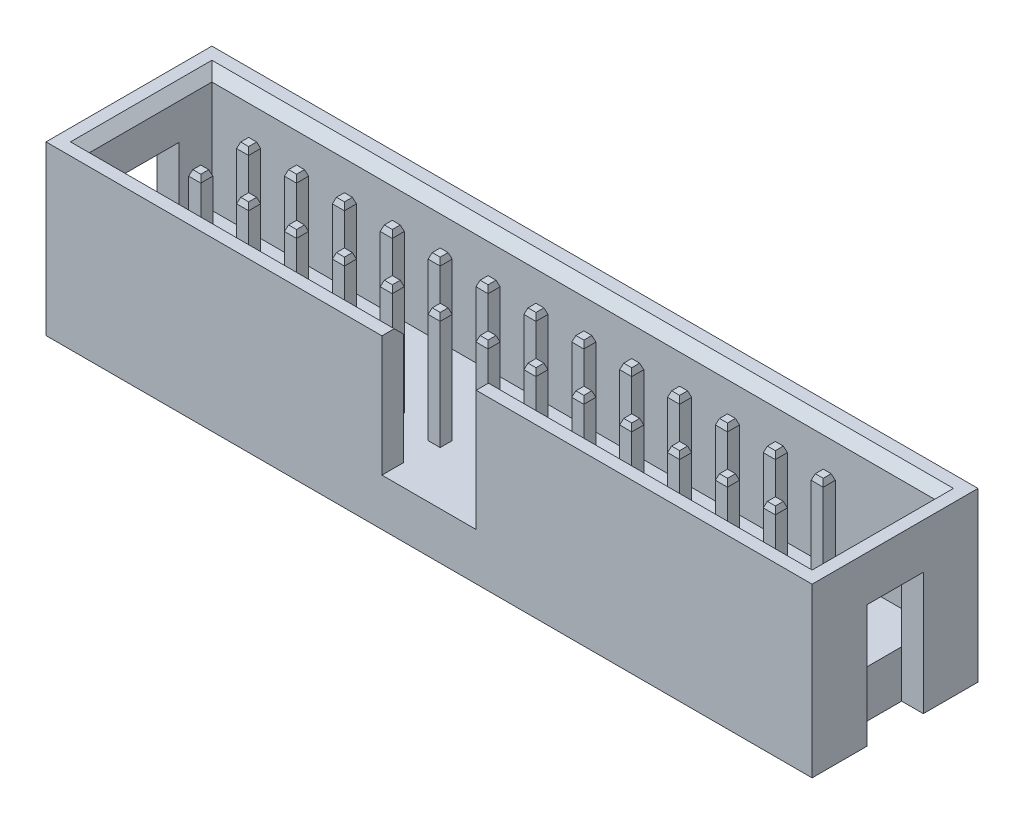
from build123d import *
from OCP.BRepFilletAPI import BRepFilletAPI_MakeChamfer

# Parameters (mm, degrees)
SKETCH1_W                = 40.64
SKETCH1_H                = 8.8
BOSS_EXTRUDE1_DEPTH      = 2.5
BOSS_EXTRUDE2_DEPTH      = 6.4
SKETCH3_W                = 1.15
SKETCH3_H                = 3
CUT_EXTRUDE1_DEPTH       = 6.5
BOSS_EXTRUDE3_DEPTH      = 6.1
BOSS_EXTRUDE3_DEPTH_BACK = 5.5
SKETCH4_W                = 0.64
SKETCH4_H                = 0.64
CHAMFER2_SIZE            = 0.2
CHAMFER2_SIZE2           = 0.549495484
CHAMFER3_SIZE            = 0.3
CHAMFER3_SIZE2           = 0.10919107
CHAMFER4_SIZE            = 0.5


with BuildPart() as part:
    # Sketch1 → Boss-Extrude1 (new body)
    with BuildSketch(Plane(origin=(0, 0, 0), x_dir=(1, 0, 0), z_dir=(0, 1, 0))):
        Rectangle(SKETCH1_W, SKETCH1_H)
    extrude(amount=BOSS_EXTRUDE1_DEPTH)

    # Sketch2 → Boss-Extrude2 (add)
    with BuildSketch(Plane(origin=(0, 2.5, 0), x_dir=(1, 0, 0), z_dir=(0, 1, 0))):
        Polygon((20.32, 4.4), (-20.32, 4.4), (-20.32, -4.4), (-2.5, -4.4), (-2.5, -3.25), (-19.17, -3.25), (-19.17, 3.25), (19.17, 3.25), (19.17, -3.25), (2.5, -3.25), (2.5, -4.4), (20.32, -4.4), align=None)
    extrude(amount=BOSS_EXTRUDE2_DEPTH)

    # Sketch3 → Cut-Extrude1 (cut)
    with BuildSketch(Plane.XZ):
        with Locations((19.745, 0)):
            Rectangle(SKETCH3_W, SKETCH3_H)
        with Locations((-19.745, 0)):
            Rectangle(SKETCH3_W, SKETCH3_H)
    extrude(amount=-CUT_EXTRUDE1_DEPTH, mode=Mode.SUBTRACT)

    # Sketch4 → Boss-Extrude3 (add, two sides: drawn at the far end of the back side and taken through both)
    with BuildSketch(Plane(origin=(0, 2.5, 0), x_dir=(1, 0, 0), z_dir=(0, 1, 0)).offset(-BOSS_EXTRUDE3_DEPTH_BACK)):
        with Locations((-15.24, 1.27)):
            Rectangle(SKETCH4_W, SKETCH4_H)
        with Locations((-12.7, 1.27)):
            Rectangle(SKETCH4_W, SKETCH4_H)
        with Locations((-10.16, 1.27)):
            Rectangle(SKETCH4_W, SKETCH4_H)
        with Locations((-7.62, 1.27)):
            Rectangle(SKETCH4_W, SKETCH4_H)
        with Locations((-5.08, 1.27)):
            Rectangle(SKETCH4_W, SKETCH4_H)
        with Locations((-2.54, 1.27)):
            Rectangle(SKETCH4_W, SKETCH4_H)
        with Locations((0, 1.27)):
            Rectangle(SKETCH4_W, SKETCH4_H)
        with Locations((2.54, 1.27)):
            Rectangle(SKETCH4_W, SKETCH4_H)
        with Locations((5.08, 1.27)):
            Rectangle(SKETCH4_W, SKETCH4_H)
        with Locations((7.62, 1.27)):
            Rectangle(SKETCH4_W, SKETCH4_H)
        with Locations((10.16, 1.27)):
            Rectangle(SKETCH4_W, SKETCH4_H)
        with Locations((12.7, 1.27)):
            Rectangle(SKETCH4_W, SKETCH4_H)
        with Locations((15.24, 1.27)):
            Rectangle(SKETCH4_W, SKETCH4_H)
        with Locations((-12.7, -1.27)):
            Rectangle(SKETCH4_W, SKETCH4_H)
        with Locations((-10.16, -1.27)):
            Rectangle(SKETCH4_W, SKETCH4_H)
        with Locations((-7.62, -1.27)):
            Rectangle(SKETCH4_W, SKETCH4_H)
        with Locations((-5.08, -1.27)):
            Rectangle(SKETCH4_W, SKETCH4_H)
        with Locations((-2.54, -1.27)):
            Rectangle(SKETCH4_W, SKETCH4_H)
        with Locations((0, -1.27)):
            Rectangle(SKETCH4_W, SKETCH4_H)
        with Locations((2.54, -1.27)):
            Rectangle(SKETCH4_W, SKETCH4_H)
        with Locations((5.08, -1.27)):
            Rectangle(SKETCH4_W, SKETCH4_H)
        with Locations((7.62, -1.27)):
            Rectangle(SKETCH4_W, SKETCH4_H)
        with Locations((10.16, -1.27)):
            Rectangle(SKETCH4_W, SKETCH4_H)
        with Locations((12.7, -1.27)):
            Rectangle(SKETCH4_W, SKETCH4_H)
        with Locations((15.24, -1.27)):
            Rectangle(SKETCH4_W, SKETCH4_H)
        with Locations((-15.24, -1.27)):
            Rectangle(SKETCH4_W, SKETCH4_H)
    extrude(amount=BOSS_EXTRUDE3_DEPTH + BOSS_EXTRUDE3_DEPTH_BACK)

    # Chamfer2: one chamfer whose edges measure the first distance from different faces: ONE call of the kernel's chamfer builder (chamfer() names one face for all edges)
    chamfer2_edges_1 = [part.edges().sort_by_distance(p)[0] for p in [
        (-14.92, -3, 1.27),
        (-15.24, -3, 0.95),
        (-15.56, -3, 1.27),
        (-15.24, -3, 1.59),
    ]]
    chamfer2_side_1 = [part.faces().sort_by_distance(p)[0] for p in [
        (-15.24, -3, 1.27),
    ]]
    chamfer2_edges_2 = [part.edges().sort_by_distance(p)[0] for p in [
        (15.56, -3, 1.27),
        (15.24, -3, 0.95),
        (14.92, -3, 1.27),
        (15.24, -3, 1.59),
    ]]
    chamfer2_side_2 = [part.faces().sort_by_distance(p)[0] for p in [
        (15.24, -3, 1.27),
    ]]
    chamfer2_edges_3 = [part.edges().sort_by_distance(p)[0] for p in [
        (13.02, -3, 1.27),
        (12.7, -3, 0.95),
        (12.38, -3, 1.27),
        (12.7, -3, 1.59),
    ]]
    chamfer2_side_3 = [part.faces().sort_by_distance(p)[0] for p in [
        (12.7, -3, 1.27),
    ]]
    chamfer2_edges_4 = [part.edges().sort_by_distance(p)[0] for p in [
        (10.48, -3, 1.27),
        (10.16, -3, 0.95),
        (9.84, -3, 1.27),
        (10.16, -3, 1.59),
    ]]
    chamfer2_side_4 = [part.faces().sort_by_distance(p)[0] for p in [
        (10.16, -3, 1.27),
    ]]
    chamfer2_edges_5 = [part.edges().sort_by_distance(p)[0] for p in [
        (7.94, -3, 1.27),
        (7.62, -3, 0.95),
        (7.3, -3, 1.27),
        (7.62, -3, 1.59),
    ]]
    chamfer2_side_5 = [part.faces().sort_by_distance(p)[0] for p in [
        (7.62, -3, 1.27),
    ]]
    chamfer2_edges_6 = [part.edges().sort_by_distance(p)[0] for p in [
        (5.4, -3, 1.27),
        (5.08, -3, 0.95),
        (4.76, -3, 1.27),
        (5.08, -3, 1.59),
    ]]
    chamfer2_side_6 = [part.faces().sort_by_distance(p)[0] for p in [
        (5.08, -3, 1.27),
    ]]
    chamfer2_edges_7 = [part.edges().sort_by_distance(p)[0] for p in [
        (2.86, -3, 1.27),
        (2.54, -3, 0.95),
        (2.22, -3, 1.27),
        (2.54, -3, 1.59),
    ]]
    chamfer2_side_7 = [part.faces().sort_by_distance(p)[0] for p in [
        (2.54, -3, 1.27),
    ]]
    chamfer2_edges_8 = [part.edges().sort_by_distance(p)[0] for p in [
        (0.32, -3, 1.27),
        (0, -3, 0.95),
        (-0.32, -3, 1.27),
        (0, -3, 1.59),
    ]]
    chamfer2_side_8 = [part.faces().sort_by_distance(p)[0] for p in [
        (0, -3, 1.27),
    ]]
    chamfer2_edges_9 = [part.edges().sort_by_distance(p)[0] for p in [
        (-2.22, -3, 1.27),
        (-2.54, -3, 0.95),
        (-2.86, -3, 1.27),
        (-2.54, -3, 1.59),
    ]]
    chamfer2_side_9 = [part.faces().sort_by_distance(p)[0] for p in [
        (-2.54, -3, 1.27),
    ]]
    chamfer2_edges_10 = [part.edges().sort_by_distance(p)[0] for p in [
        (-4.76, -3, 1.27),
        (-5.08, -3, 0.95),
        (-5.4, -3, 1.27),
        (-5.08, -3, 1.59),
    ]]
    chamfer2_side_10 = [part.faces().sort_by_distance(p)[0] for p in [
        (-5.08, -3, 1.27),
    ]]
    chamfer2_edges_11 = [part.edges().sort_by_distance(p)[0] for p in [
        (-7.3, -3, 1.27),
        (-7.62, -3, 0.95),
        (-7.94, -3, 1.27),
        (-7.62, -3, 1.59),
    ]]
    chamfer2_side_11 = [part.faces().sort_by_distance(p)[0] for p in [
        (-7.62, -3, 1.27),
    ]]
    chamfer2_edges_12 = [part.edges().sort_by_distance(p)[0] for p in [
        (-9.84, -3, 1.27),
        (-10.16, -3, 0.95),
        (-10.48, -3, 1.27),
        (-10.16, -3, 1.59),
    ]]
    chamfer2_side_12 = [part.faces().sort_by_distance(p)[0] for p in [
        (-10.16, -3, 1.27),
    ]]
    chamfer2_edges_13 = [part.edges().sort_by_distance(p)[0] for p in [
        (-12.38, -3, 1.27),
        (-12.7, -3, 0.95),
        (-13.02, -3, 1.27),
        (-12.7, -3, 1.59),
    ]]
    chamfer2_side_13 = [part.faces().sort_by_distance(p)[0] for p in [
        (-12.7, -3, 1.27),
    ]]
    chamfer2_edges_14 = [part.edges().sort_by_distance(p)[0] for p in [
        (15.56, -3, -1.27),
        (15.24, -3, -1.59),
        (14.92, -3, -1.27),
        (15.24, -3, -0.95),
    ]]
    chamfer2_side_14 = [part.faces().sort_by_distance(p)[0] for p in [
        (15.24, -3, -1.27),
    ]]
    chamfer2_edges_15 = [part.edges().sort_by_distance(p)[0] for p in [
        (13.02, -3, -1.27),
        (12.7, -3, -1.59),
        (12.38, -3, -1.27),
        (12.7, -3, -0.95),
    ]]
    chamfer2_side_15 = [part.faces().sort_by_distance(p)[0] for p in [
        (12.7, -3, -1.27),
    ]]
    chamfer2_edges_16 = [part.edges().sort_by_distance(p)[0] for p in [
        (10.48, -3, -1.27),
        (10.16, -3, -1.59),
        (9.84, -3, -1.27),
        (10.16, -3, -0.95),
    ]]
    chamfer2_side_16 = [part.faces().sort_by_distance(p)[0] for p in [
        (10.16, -3, -1.27),
    ]]
    chamfer2_edges_17 = [part.edges().sort_by_distance(p)[0] for p in [
        (7.94, -3, -1.27),
        (7.62, -3, -1.59),
        (7.3, -3, -1.27),
        (7.62, -3, -0.95),
    ]]
    chamfer2_side_17 = [part.faces().sort_by_distance(p)[0] for p in [
        (7.62, -3, -1.27),
    ]]
    chamfer2_edges_18 = [part.edges().sort_by_distance(p)[0] for p in [
        (5.4, -3, -1.27),
        (5.08, -3, -1.59),
        (4.76, -3, -1.27),
        (5.08, -3, -0.95),
    ]]
    chamfer2_side_18 = [part.faces().sort_by_distance(p)[0] for p in [
        (5.08, -3, -1.27),
    ]]
    chamfer2_edges_19 = [part.edges().sort_by_distance(p)[0] for p in [
        (2.86, -3, -1.27),
        (2.54, -3, -1.59),
        (2.22, -3, -1.27),
        (2.54, -3, -0.95),
    ]]
    chamfer2_side_19 = [part.faces().sort_by_distance(p)[0] for p in [
        (2.54, -3, -1.27),
    ]]
    chamfer2_edges_20 = [part.edges().sort_by_distance(p)[0] for p in [
        (0.32, -3, -1.27),
        (0, -3, -1.59),
        (-0.32, -3, -1.27),
        (0, -3, -0.95),
    ]]
    chamfer2_side_20 = [part.faces().sort_by_distance(p)[0] for p in [
        (0, -3, -1.27),
    ]]
    chamfer2_edges_21 = [part.edges().sort_by_distance(p)[0] for p in [
        (-2.22, -3, -1.27),
        (-2.54, -3, -1.59),
        (-2.86, -3, -1.27),
        (-2.54, -3, -0.95),
    ]]
    chamfer2_side_21 = [part.faces().sort_by_distance(p)[0] for p in [
        (-2.54, -3, -1.27),
    ]]
    chamfer2_edges_22 = [part.edges().sort_by_distance(p)[0] for p in [
        (-4.76, -3, -1.27),
        (-5.08, -3, -1.59),
        (-5.4, -3, -1.27),
        (-5.08, -3, -0.95),
    ]]
    chamfer2_side_22 = [part.faces().sort_by_distance(p)[0] for p in [
        (-5.08, -3, -1.27),
    ]]
    chamfer2_edges_23 = [part.edges().sort_by_distance(p)[0] for p in [
        (-7.3, -3, -1.27),
        (-7.62, -3, -1.59),
        (-7.94, -3, -1.27),
        (-7.62, -3, -0.95),
    ]]
    chamfer2_side_23 = [part.faces().sort_by_distance(p)[0] for p in [
        (-7.62, -3, -1.27),
    ]]
    chamfer2_edges_24 = [part.edges().sort_by_distance(p)[0] for p in [
        (-9.84, -3, -1.27),
        (-10.16, -3, -1.59),
        (-10.48, -3, -1.27),
        (-10.16, -3, -0.95),
    ]]
    chamfer2_side_24 = [part.faces().sort_by_distance(p)[0] for p in [
        (-10.16, -3, -1.27),
    ]]
    chamfer2_edges_25 = [part.edges().sort_by_distance(p)[0] for p in [
        (-12.38, -3, -1.27),
        (-12.7, -3, -1.59),
        (-13.02, -3, -1.27),
        (-12.7, -3, -0.95),
    ]]
    chamfer2_side_25 = [part.faces().sort_by_distance(p)[0] for p in [
        (-12.7, -3, -1.27),
    ]]
    chamfer2_edges_26 = [part.edges().sort_by_distance(p)[0] for p in [
        (-14.92, -3, -1.27),
        (-15.24, -3, -1.59),
        (-15.56, -3, -1.27),
        (-15.24, -3, -0.95),
    ]]
    chamfer2_side_26 = [part.faces().sort_by_distance(p)[0] for p in [
        (-15.24, -3, -1.27),
    ]]
    chamfer2 = BRepFilletAPI_MakeChamfer(part.part.solid().wrapped)
    for e in chamfer2_edges_1:
        chamfer2.Add(CHAMFER2_SIZE, CHAMFER2_SIZE2, e.wrapped, chamfer2_side_1[0].wrapped)  # the first distance lies on this face
    for e in chamfer2_edges_2:
        chamfer2.Add(CHAMFER2_SIZE, CHAMFER2_SIZE2, e.wrapped, chamfer2_side_2[0].wrapped)  # the first distance lies on this face
    for e in chamfer2_edges_3:
        chamfer2.Add(CHAMFER2_SIZE, CHAMFER2_SIZE2, e.wrapped, chamfer2_side_3[0].wrapped)  # the first distance lies on this face
    for e in chamfer2_edges_4:
        chamfer2.Add(CHAMFER2_SIZE, CHAMFER2_SIZE2, e.wrapped, chamfer2_side_4[0].wrapped)  # the first distance lies on this face
    for e in chamfer2_edges_5:
        chamfer2.Add(CHAMFER2_SIZE, CHAMFER2_SIZE2, e.wrapped, chamfer2_side_5[0].wrapped)  # the first distance lies on this face
    for e in chamfer2_edges_6:
        chamfer2.Add(CHAMFER2_SIZE, CHAMFER2_SIZE2, e.wrapped, chamfer2_side_6[0].wrapped)  # the first distance lies on this face
    for e in chamfer2_edges_7:
        chamfer2.Add(CHAMFER2_SIZE, CHAMFER2_SIZE2, e.wrapped, chamfer2_side_7[0].wrapped)  # the first distance lies on this face
    for e in chamfer2_edges_8:
        chamfer2.Add(CHAMFER2_SIZE, CHAMFER2_SIZE2, e.wrapped, chamfer2_side_8[0].wrapped)  # the first distance lies on this face
    for e in chamfer2_edges_9:
        chamfer2.Add(CHAMFER2_SIZE, CHAMFER2_SIZE2, e.wrapped, chamfer2_side_9[0].wrapped)  # the first distance lies on this face
    for e in chamfer2_edges_10:
        chamfer2.Add(CHAMFER2_SIZE, CHAMFER2_SIZE2, e.wrapped, chamfer2_side_10[0].wrapped)  # the first distance lies on this face
    for e in chamfer2_edges_11:
        chamfer2.Add(CHAMFER2_SIZE, CHAMFER2_SIZE2, e.wrapped, chamfer2_side_11[0].wrapped)  # the first distance lies on this face
    for e in chamfer2_edges_12:
        chamfer2.Add(CHAMFER2_SIZE, CHAMFER2_SIZE2, e.wrapped, chamfer2_side_12[0].wrapped)  # the first distance lies on this face
    for e in chamfer2_edges_13:
        chamfer2.Add(CHAMFER2_SIZE, CHAMFER2_SIZE2, e.wrapped, chamfer2_side_13[0].wrapped)  # the first distance lies on this face
    for e in chamfer2_edges_14:
        chamfer2.Add(CHAMFER2_SIZE, CHAMFER2_SIZE2, e.wrapped, chamfer2_side_14[0].wrapped)  # the first distance lies on this face
    for e in chamfer2_edges_15:
        chamfer2.Add(CHAMFER2_SIZE, CHAMFER2_SIZE2, e.wrapped, chamfer2_side_15[0].wrapped)  # the first distance lies on this face
    for e in chamfer2_edges_16:
        chamfer2.Add(CHAMFER2_SIZE, CHAMFER2_SIZE2, e.wrapped, chamfer2_side_16[0].wrapped)  # the first distance lies on this face
    for e in chamfer2_edges_17:
        chamfer2.Add(CHAMFER2_SIZE, CHAMFER2_SIZE2, e.wrapped, chamfer2_side_17[0].wrapped)  # the first distance lies on this face
    for e in chamfer2_edges_18:
        chamfer2.Add(CHAMFER2_SIZE, CHAMFER2_SIZE2, e.wrapped, chamfer2_side_18[0].wrapped)  # the first distance lies on this face
    for e in chamfer2_edges_19:
        chamfer2.Add(CHAMFER2_SIZE, CHAMFER2_SIZE2, e.wrapped, chamfer2_side_19[0].wrapped)  # the first distance lies on this face
    for e in chamfer2_edges_20:
        chamfer2.Add(CHAMFER2_SIZE, CHAMFER2_SIZE2, e.wrapped, chamfer2_side_20[0].wrapped)  # the first distance lies on this face
    for e in chamfer2_edges_21:
        chamfer2.Add(CHAMFER2_SIZE, CHAMFER2_SIZE2, e.wrapped, chamfer2_side_21[0].wrapped)  # the first distance lies on this face
    for e in chamfer2_edges_22:
        chamfer2.Add(CHAMFER2_SIZE, CHAMFER2_SIZE2, e.wrapped, chamfer2_side_22[0].wrapped)  # the first distance lies on this face
    for e in chamfer2_edges_23:
        chamfer2.Add(CHAMFER2_SIZE, CHAMFER2_SIZE2, e.wrapped, chamfer2_side_23[0].wrapped)  # the first distance lies on this face
    for e in chamfer2_edges_24:
        chamfer2.Add(CHAMFER2_SIZE, CHAMFER2_SIZE2, e.wrapped, chamfer2_side_24[0].wrapped)  # the first distance lies on this face
    for e in chamfer2_edges_25:
        chamfer2.Add(CHAMFER2_SIZE, CHAMFER2_SIZE2, e.wrapped, chamfer2_side_25[0].wrapped)  # the first distance lies on this face
    for e in chamfer2_edges_26:
        chamfer2.Add(CHAMFER2_SIZE, CHAMFER2_SIZE2, e.wrapped, chamfer2_side_26[0].wrapped)  # the first distance lies on this face
    add(Compound.cast(chamfer2.Shape()), mode=Mode.REPLACE)

    # Chamfer3: one chamfer whose edges measure the first distance from different faces: ONE call of the kernel's chamfer builder (chamfer() names one face for all edges)
    chamfer3_edges_1 = [part.edges().sort_by_distance(p)[0] for p in [
        (-14.92, 8.6, 1.27),
    ]]
    chamfer3_side_1 = [part.faces().sort_by_distance(p)[0] for p in [
        (-14.92, 5.55, 1.27),
    ]]
    chamfer3_edges_2 = [part.edges().sort_by_distance(p)[0] for p in [
        (-15.24, 8.6, 0.95),
    ]]
    chamfer3_side_2 = [part.faces().sort_by_distance(p)[0] for p in [
        (-15.24, 5.55, 0.95),
    ]]
    chamfer3_edges_3 = [part.edges().sort_by_distance(p)[0] for p in [
        (-15.56, 8.6, 1.27),
    ]]
    chamfer3_side_3 = [part.faces().sort_by_distance(p)[0] for p in [
        (-15.56, 5.55, 1.27),
    ]]
    chamfer3_edges_4 = [part.edges().sort_by_distance(p)[0] for p in [
        (-15.24, 8.6, 1.59),
    ]]
    chamfer3_side_4 = [part.faces().sort_by_distance(p)[0] for p in [
        (-15.24, 5.55, 1.59),
    ]]
    chamfer3_edges_5 = [part.edges().sort_by_distance(p)[0] for p in [
        (15.56, 8.6, 1.27),
    ]]
    chamfer3_side_5 = [part.faces().sort_by_distance(p)[0] for p in [
        (15.56, 5.55, 1.27),
    ]]
    chamfer3_edges_6 = [part.edges().sort_by_distance(p)[0] for p in [
        (15.24, 8.6, 0.95),
    ]]
    chamfer3_side_6 = [part.faces().sort_by_distance(p)[0] for p in [
        (15.24, 5.55, 0.95),
    ]]
    chamfer3_edges_7 = [part.edges().sort_by_distance(p)[0] for p in [
        (14.92, 8.6, 1.27),
    ]]
    chamfer3_side_7 = [part.faces().sort_by_distance(p)[0] for p in [
        (14.92, 5.55, 1.27),
    ]]
    chamfer3_edges_8 = [part.edges().sort_by_distance(p)[0] for p in [
        (15.24, 8.6, 1.59),
    ]]
    chamfer3_side_8 = [part.faces().sort_by_distance(p)[0] for p in [
        (15.24, 5.55, 1.59),
    ]]
    chamfer3_edges_9 = [part.edges().sort_by_distance(p)[0] for p in [
        (13.02, 8.6, 1.27),
    ]]
    chamfer3_side_9 = [part.faces().sort_by_distance(p)[0] for p in [
        (13.02, 5.55, 1.27),
    ]]
    chamfer3_edges_10 = [part.edges().sort_by_distance(p)[0] for p in [
        (12.7, 8.6, 0.95),
    ]]
    chamfer3_side_10 = [part.faces().sort_by_distance(p)[0] for p in [
        (12.7, 5.55, 0.95),
    ]]
    chamfer3_edges_11 = [part.edges().sort_by_distance(p)[0] for p in [
        (12.38, 8.6, 1.27),
    ]]
    chamfer3_side_11 = [part.faces().sort_by_distance(p)[0] for p in [
        (12.38, 5.55, 1.27),
    ]]
    chamfer3_edges_12 = [part.edges().sort_by_distance(p)[0] for p in [
        (12.7, 8.6, 1.59),
    ]]
    chamfer3_side_12 = [part.faces().sort_by_distance(p)[0] for p in [
        (12.7, 5.55, 1.59),
    ]]
    chamfer3_edges_13 = [part.edges().sort_by_distance(p)[0] for p in [
        (10.48, 8.6, 1.27),
    ]]
    chamfer3_side_13 = [part.faces().sort_by_distance(p)[0] for p in [
        (10.48, 5.55, 1.27),
    ]]
    chamfer3_edges_14 = [part.edges().sort_by_distance(p)[0] for p in [
        (10.16, 8.6, 0.95),
    ]]
    chamfer3_side_14 = [part.faces().sort_by_distance(p)[0] for p in [
        (10.16, 5.55, 0.95),
    ]]
    chamfer3_edges_15 = [part.edges().sort_by_distance(p)[0] for p in [
        (9.84, 8.6, 1.27),
    ]]
    chamfer3_side_15 = [part.faces().sort_by_distance(p)[0] for p in [
        (9.84, 5.55, 1.27),
    ]]
    chamfer3_edges_16 = [part.edges().sort_by_distance(p)[0] for p in [
        (10.16, 8.6, 1.59),
    ]]
    chamfer3_side_16 = [part.faces().sort_by_distance(p)[0] for p in [
        (10.16, 5.55, 1.59),
    ]]
    chamfer3_edges_17 = [part.edges().sort_by_distance(p)[0] for p in [
        (7.94, 8.6, 1.27),
    ]]
    chamfer3_side_17 = [part.faces().sort_by_distance(p)[0] for p in [
        (7.94, 5.55, 1.27),
    ]]
    chamfer3_edges_18 = [part.edges().sort_by_distance(p)[0] for p in [
        (7.62, 8.6, 0.95),
    ]]
    chamfer3_side_18 = [part.faces().sort_by_distance(p)[0] for p in [
        (7.62, 5.55, 0.95),
    ]]
    chamfer3_edges_19 = [part.edges().sort_by_distance(p)[0] for p in [
        (7.3, 8.6, 1.27),
    ]]
    chamfer3_side_19 = [part.faces().sort_by_distance(p)[0] for p in [
        (7.3, 5.55, 1.27),
    ]]
    chamfer3_edges_20 = [part.edges().sort_by_distance(p)[0] for p in [
        (7.62, 8.6, 1.59),
    ]]
    chamfer3_side_20 = [part.faces().sort_by_distance(p)[0] for p in [
        (7.62, 5.55, 1.59),
    ]]
    chamfer3_edges_21 = [part.edges().sort_by_distance(p)[0] for p in [
        (5.4, 8.6, 1.27),
    ]]
    chamfer3_side_21 = [part.faces().sort_by_distance(p)[0] for p in [
        (5.4, 5.55, 1.27),
    ]]
    chamfer3_edges_22 = [part.edges().sort_by_distance(p)[0] for p in [
        (5.08, 8.6, 0.95),
    ]]
    chamfer3_side_22 = [part.faces().sort_by_distance(p)[0] for p in [
        (5.08, 5.55, 0.95),
    ]]
    chamfer3_edges_23 = [part.edges().sort_by_distance(p)[0] for p in [
        (4.76, 8.6, 1.27),
    ]]
    chamfer3_side_23 = [part.faces().sort_by_distance(p)[0] for p in [
        (4.76, 5.55, 1.27),
    ]]
    chamfer3_edges_24 = [part.edges().sort_by_distance(p)[0] for p in [
        (5.08, 8.6, 1.59),
    ]]
    chamfer3_side_24 = [part.faces().sort_by_distance(p)[0] for p in [
        (5.08, 5.55, 1.59),
    ]]
    chamfer3_edges_25 = [part.edges().sort_by_distance(p)[0] for p in [
        (2.86, 8.6, 1.27),
    ]]
    chamfer3_side_25 = [part.faces().sort_by_distance(p)[0] for p in [
        (2.86, 5.55, 1.27),
    ]]
    chamfer3_edges_26 = [part.edges().sort_by_distance(p)[0] for p in [
        (2.54, 8.6, 0.95),
    ]]
    chamfer3_side_26 = [part.faces().sort_by_distance(p)[0] for p in [
        (2.54, 5.55, 0.95),
    ]]
    chamfer3_edges_27 = [part.edges().sort_by_distance(p)[0] for p in [
        (2.22, 8.6, 1.27),
    ]]
    chamfer3_side_27 = [part.faces().sort_by_distance(p)[0] for p in [
        (2.22, 5.55, 1.27),
    ]]
    chamfer3_edges_28 = [part.edges().sort_by_distance(p)[0] for p in [
        (2.54, 8.6, 1.59),
    ]]
    chamfer3_side_28 = [part.faces().sort_by_distance(p)[0] for p in [
        (2.54, 5.55, 1.59),
    ]]
    chamfer3_edges_29 = [part.edges().sort_by_distance(p)[0] for p in [
        (0.32, 8.6, 1.27),
    ]]
    chamfer3_side_29 = [part.faces().sort_by_distance(p)[0] for p in [
        (0.32, 5.55, 1.27),
    ]]
    chamfer3_edges_30 = [part.edges().sort_by_distance(p)[0] for p in [
        (0, 8.6, 0.95),
    ]]
    chamfer3_side_30 = [part.faces().sort_by_distance(p)[0] for p in [
        (0, 5.55, 0.95),
    ]]
    chamfer3_edges_31 = [part.edges().sort_by_distance(p)[0] for p in [
        (-0.32, 8.6, 1.27),
    ]]
    chamfer3_side_31 = [part.faces().sort_by_distance(p)[0] for p in [
        (-0.32, 5.55, 1.27),
    ]]
    chamfer3_edges_32 = [part.edges().sort_by_distance(p)[0] for p in [
        (0, 8.6, 1.59),
    ]]
    chamfer3_side_32 = [part.faces().sort_by_distance(p)[0] for p in [
        (0, 5.55, 1.59),
    ]]
    chamfer3_edges_33 = [part.edges().sort_by_distance(p)[0] for p in [
        (-2.22, 8.6, 1.27),
    ]]
    chamfer3_side_33 = [part.faces().sort_by_distance(p)[0] for p in [
        (-2.22, 5.55, 1.27),
    ]]
    chamfer3_edges_34 = [part.edges().sort_by_distance(p)[0] for p in [
        (-2.54, 8.6, 0.95),
    ]]
    chamfer3_side_34 = [part.faces().sort_by_distance(p)[0] for p in [
        (-2.54, 5.55, 0.95),
    ]]
    chamfer3_edges_35 = [part.edges().sort_by_distance(p)[0] for p in [
        (-2.86, 8.6, 1.27),
    ]]
    chamfer3_side_35 = [part.faces().sort_by_distance(p)[0] for p in [
        (-2.86, 5.55, 1.27),
    ]]
    chamfer3_edges_36 = [part.edges().sort_by_distance(p)[0] for p in [
        (-2.54, 8.6, 1.59),
    ]]
    chamfer3_side_36 = [part.faces().sort_by_distance(p)[0] for p in [
        (-2.54, 5.55, 1.59),
    ]]
    chamfer3_edges_37 = [part.edges().sort_by_distance(p)[0] for p in [
        (-4.76, 8.6, 1.27),
    ]]
    chamfer3_side_37 = [part.faces().sort_by_distance(p)[0] for p in [
        (-4.76, 5.55, 1.27),
    ]]
    chamfer3_edges_38 = [part.edges().sort_by_distance(p)[0] for p in [
        (-5.08, 8.6, 0.95),
    ]]
    chamfer3_side_38 = [part.faces().sort_by_distance(p)[0] for p in [
        (-5.08, 5.55, 0.95),
    ]]
    chamfer3_edges_39 = [part.edges().sort_by_distance(p)[0] for p in [
        (-5.4, 8.6, 1.27),
    ]]
    chamfer3_side_39 = [part.faces().sort_by_distance(p)[0] for p in [
        (-5.4, 5.55, 1.27),
    ]]
    chamfer3_edges_40 = [part.edges().sort_by_distance(p)[0] for p in [
        (-5.08, 8.6, 1.59),
    ]]
    chamfer3_side_40 = [part.faces().sort_by_distance(p)[0] for p in [
        (-5.08, 5.55, 1.59),
    ]]
    chamfer3_edges_41 = [part.edges().sort_by_distance(p)[0] for p in [
        (-7.3, 8.6, 1.27),
    ]]
    chamfer3_side_41 = [part.faces().sort_by_distance(p)[0] for p in [
        (-7.3, 5.55, 1.27),
    ]]
    chamfer3_edges_42 = [part.edges().sort_by_distance(p)[0] for p in [
        (-7.62, 8.6, 0.95),
    ]]
    chamfer3_side_42 = [part.faces().sort_by_distance(p)[0] for p in [
        (-7.62, 5.55, 0.95),
    ]]
    chamfer3_edges_43 = [part.edges().sort_by_distance(p)[0] for p in [
        (-7.94, 8.6, 1.27),
    ]]
    chamfer3_side_43 = [part.faces().sort_by_distance(p)[0] for p in [
        (-7.94, 5.55, 1.27),
    ]]
    chamfer3_edges_44 = [part.edges().sort_by_distance(p)[0] for p in [
        (-7.62, 8.6, 1.59),
    ]]
    chamfer3_side_44 = [part.faces().sort_by_distance(p)[0] for p in [
        (-7.62, 5.55, 1.59),
    ]]
    chamfer3_edges_45 = [part.edges().sort_by_distance(p)[0] for p in [
        (-9.84, 8.6, 1.27),
    ]]
    chamfer3_side_45 = [part.faces().sort_by_distance(p)[0] for p in [
        (-9.84, 5.55, 1.27),
    ]]
    chamfer3_edges_46 = [part.edges().sort_by_distance(p)[0] for p in [
        (-10.16, 8.6, 0.95),
    ]]
    chamfer3_side_46 = [part.faces().sort_by_distance(p)[0] for p in [
        (-10.16, 5.55, 0.95),
    ]]
    chamfer3_edges_47 = [part.edges().sort_by_distance(p)[0] for p in [
        (-10.48, 8.6, 1.27),
    ]]
    chamfer3_side_47 = [part.faces().sort_by_distance(p)[0] for p in [
        (-10.48, 5.55, 1.27),
    ]]
    chamfer3_edges_48 = [part.edges().sort_by_distance(p)[0] for p in [
        (-10.16, 8.6, 1.59),
    ]]
    chamfer3_side_48 = [part.faces().sort_by_distance(p)[0] for p in [
        (-10.16, 5.55, 1.59),
    ]]
    chamfer3_edges_49 = [part.edges().sort_by_distance(p)[0] for p in [
        (-12.38, 8.6, 1.27),
    ]]
    chamfer3_side_49 = [part.faces().sort_by_distance(p)[0] for p in [
        (-12.38, 5.55, 1.27),
    ]]
    chamfer3_edges_50 = [part.edges().sort_by_distance(p)[0] for p in [
        (-12.7, 8.6, 0.95),
    ]]
    chamfer3_side_50 = [part.faces().sort_by_distance(p)[0] for p in [
        (-12.7, 5.55, 0.95),
    ]]
    chamfer3_edges_51 = [part.edges().sort_by_distance(p)[0] for p in [
        (-13.02, 8.6, 1.27),
    ]]
    chamfer3_side_51 = [part.faces().sort_by_distance(p)[0] for p in [
        (-13.02, 5.55, 1.27),
    ]]
    chamfer3_edges_52 = [part.edges().sort_by_distance(p)[0] for p in [
        (-12.7, 8.6, 1.59),
    ]]
    chamfer3_side_52 = [part.faces().sort_by_distance(p)[0] for p in [
        (-12.7, 5.55, 1.59),
    ]]
    chamfer3_edges_53 = [part.edges().sort_by_distance(p)[0] for p in [
        (15.56, 8.6, -1.27),
    ]]
    chamfer3_side_53 = [part.faces().sort_by_distance(p)[0] for p in [
        (15.56, 5.55, -1.27),
    ]]
    chamfer3_edges_54 = [part.edges().sort_by_distance(p)[0] for p in [
        (15.24, 8.6, -1.59),
    ]]
    chamfer3_side_54 = [part.faces().sort_by_distance(p)[0] for p in [
        (15.24, 5.55, -1.59),
    ]]
    chamfer3_edges_55 = [part.edges().sort_by_distance(p)[0] for p in [
        (14.92, 8.6, -1.27),
    ]]
    chamfer3_side_55 = [part.faces().sort_by_distance(p)[0] for p in [
        (14.92, 5.55, -1.27),
    ]]
    chamfer3_edges_56 = [part.edges().sort_by_distance(p)[0] for p in [
        (15.24, 8.6, -0.95),
    ]]
    chamfer3_side_56 = [part.faces().sort_by_distance(p)[0] for p in [
        (15.24, 5.55, -0.95),
    ]]
    chamfer3_edges_57 = [part.edges().sort_by_distance(p)[0] for p in [
        (13.02, 8.6, -1.27),
    ]]
    chamfer3_side_57 = [part.faces().sort_by_distance(p)[0] for p in [
        (13.02, 5.55, -1.27),
    ]]
    chamfer3_edges_58 = [part.edges().sort_by_distance(p)[0] for p in [
        (12.7, 8.6, -1.59),
    ]]
    chamfer3_side_58 = [part.faces().sort_by_distance(p)[0] for p in [
        (12.7, 5.55, -1.59),
    ]]
    chamfer3_edges_59 = [part.edges().sort_by_distance(p)[0] for p in [
        (12.38, 8.6, -1.27),
    ]]
    chamfer3_side_59 = [part.faces().sort_by_distance(p)[0] for p in [
        (12.38, 5.55, -1.27),
    ]]
    chamfer3_edges_60 = [part.edges().sort_by_distance(p)[0] for p in [
        (12.7, 8.6, -0.95),
    ]]
    chamfer3_side_60 = [part.faces().sort_by_distance(p)[0] for p in [
        (12.7, 5.55, -0.95),
    ]]
    chamfer3_edges_61 = [part.edges().sort_by_distance(p)[0] for p in [
        (10.48, 8.6, -1.27),
    ]]
    chamfer3_side_61 = [part.faces().sort_by_distance(p)[0] for p in [
        (10.48, 5.55, -1.27),
    ]]
    chamfer3_edges_62 = [part.edges().sort_by_distance(p)[0] for p in [
        (10.16, 8.6, -1.59),
    ]]
    chamfer3_side_62 = [part.faces().sort_by_distance(p)[0] for p in [
        (10.16, 5.55, -1.59),
    ]]
    chamfer3_edges_63 = [part.edges().sort_by_distance(p)[0] for p in [
        (9.84, 8.6, -1.27),
    ]]
    chamfer3_side_63 = [part.faces().sort_by_distance(p)[0] for p in [
        (9.84, 5.55, -1.27),
    ]]
    chamfer3_edges_64 = [part.edges().sort_by_distance(p)[0] for p in [
        (10.16, 8.6, -0.95),
    ]]
    chamfer3_side_64 = [part.faces().sort_by_distance(p)[0] for p in [
        (10.16, 5.55, -0.95),
    ]]
    chamfer3_edges_65 = [part.edges().sort_by_distance(p)[0] for p in [
        (7.94, 8.6, -1.27),
    ]]
    chamfer3_side_65 = [part.faces().sort_by_distance(p)[0] for p in [
        (7.94, 5.55, -1.27),
    ]]
    chamfer3_edges_66 = [part.edges().sort_by_distance(p)[0] for p in [
        (7.62, 8.6, -1.59),
    ]]
    chamfer3_side_66 = [part.faces().sort_by_distance(p)[0] for p in [
        (7.62, 5.55, -1.59),
    ]]
    chamfer3_edges_67 = [part.edges().sort_by_distance(p)[0] for p in [
        (7.3, 8.6, -1.27),
    ]]
    chamfer3_side_67 = [part.faces().sort_by_distance(p)[0] for p in [
        (7.3, 5.55, -1.27),
    ]]
    chamfer3_edges_68 = [part.edges().sort_by_distance(p)[0] for p in [
        (7.62, 8.6, -0.95),
    ]]
    chamfer3_side_68 = [part.faces().sort_by_distance(p)[0] for p in [
        (7.62, 5.55, -0.95),
    ]]
    chamfer3_edges_69 = [part.edges().sort_by_distance(p)[0] for p in [
        (5.4, 8.6, -1.27),
    ]]
    chamfer3_side_69 = [part.faces().sort_by_distance(p)[0] for p in [
        (5.4, 5.55, -1.27),
    ]]
    chamfer3_edges_70 = [part.edges().sort_by_distance(p)[0] for p in [
        (5.08, 8.6, -1.59),
    ]]
    chamfer3_side_70 = [part.faces().sort_by_distance(p)[0] for p in [
        (5.08, 5.55, -1.59),
    ]]
    chamfer3_edges_71 = [part.edges().sort_by_distance(p)[0] for p in [
        (4.76, 8.6, -1.27),
    ]]
    chamfer3_side_71 = [part.faces().sort_by_distance(p)[0] for p in [
        (4.76, 5.55, -1.27),
    ]]
    chamfer3_edges_72 = [part.edges().sort_by_distance(p)[0] for p in [
        (5.08, 8.6, -0.95),
    ]]
    chamfer3_side_72 = [part.faces().sort_by_distance(p)[0] for p in [
        (5.08, 5.55, -0.95),
    ]]
    chamfer3_edges_73 = [part.edges().sort_by_distance(p)[0] for p in [
        (2.86, 8.6, -1.27),
    ]]
    chamfer3_side_73 = [part.faces().sort_by_distance(p)[0] for p in [
        (2.86, 5.55, -1.27),
    ]]
    chamfer3_edges_74 = [part.edges().sort_by_distance(p)[0] for p in [
        (2.54, 8.6, -1.59),
    ]]
    chamfer3_side_74 = [part.faces().sort_by_distance(p)[0] for p in [
        (2.54, 5.55, -1.59),
    ]]
    chamfer3_edges_75 = [part.edges().sort_by_distance(p)[0] for p in [
        (2.22, 8.6, -1.27),
    ]]
    chamfer3_side_75 = [part.faces().sort_by_distance(p)[0] for p in [
        (2.22, 5.55, -1.27),
    ]]
    chamfer3_edges_76 = [part.edges().sort_by_distance(p)[0] for p in [
        (2.54, 8.6, -0.95),
    ]]
    chamfer3_side_76 = [part.faces().sort_by_distance(p)[0] for p in [
        (2.54, 5.55, -0.95),
    ]]
    chamfer3_edges_77 = [part.edges().sort_by_distance(p)[0] for p in [
        (0.32, 8.6, -1.27),
    ]]
    chamfer3_side_77 = [part.faces().sort_by_distance(p)[0] for p in [
        (0.32, 5.55, -1.27),
    ]]
    chamfer3_edges_78 = [part.edges().sort_by_distance(p)[0] for p in [
        (0, 8.6, -1.59),
    ]]
    chamfer3_side_78 = [part.faces().sort_by_distance(p)[0] for p in [
        (0, 5.55, -1.59),
    ]]
    chamfer3_edges_79 = [part.edges().sort_by_distance(p)[0] for p in [
        (-0.32, 8.6, -1.27),
    ]]
    chamfer3_side_79 = [part.faces().sort_by_distance(p)[0] for p in [
        (-0.32, 5.55, -1.27),
    ]]
    chamfer3_edges_80 = [part.edges().sort_by_distance(p)[0] for p in [
        (0, 8.6, -0.95),
    ]]
    chamfer3_side_80 = [part.faces().sort_by_distance(p)[0] for p in [
        (0, 5.55, -0.95),
    ]]
    chamfer3_edges_81 = [part.edges().sort_by_distance(p)[0] for p in [
        (-2.22, 8.6, -1.27),
    ]]
    chamfer3_side_81 = [part.faces().sort_by_distance(p)[0] for p in [
        (-2.22, 5.55, -1.27),
    ]]
    chamfer3_edges_82 = [part.edges().sort_by_distance(p)[0] for p in [
        (-2.54, 8.6, -1.59),
    ]]
    chamfer3_side_82 = [part.faces().sort_by_distance(p)[0] for p in [
        (-2.54, 5.55, -1.59),
    ]]
    chamfer3_edges_83 = [part.edges().sort_by_distance(p)[0] for p in [
        (-2.86, 8.6, -1.27),
    ]]
    chamfer3_side_83 = [part.faces().sort_by_distance(p)[0] for p in [
        (-2.86, 5.55, -1.27),
    ]]
    chamfer3_edges_84 = [part.edges().sort_by_distance(p)[0] for p in [
        (-2.54, 8.6, -0.95),
    ]]
    chamfer3_side_84 = [part.faces().sort_by_distance(p)[0] for p in [
        (-2.54, 5.55, -0.95),
    ]]
    chamfer3_edges_85 = [part.edges().sort_by_distance(p)[0] for p in [
        (-4.76, 8.6, -1.27),
    ]]
    chamfer3_side_85 = [part.faces().sort_by_distance(p)[0] for p in [
        (-4.76, 5.55, -1.27),
    ]]
    chamfer3_edges_86 = [part.edges().sort_by_distance(p)[0] for p in [
        (-5.08, 8.6, -1.59),
    ]]
    chamfer3_side_86 = [part.faces().sort_by_distance(p)[0] for p in [
        (-5.08, 5.55, -1.59),
    ]]
    chamfer3_edges_87 = [part.edges().sort_by_distance(p)[0] for p in [
        (-5.4, 8.6, -1.27),
    ]]
    chamfer3_side_87 = [part.faces().sort_by_distance(p)[0] for p in [
        (-5.4, 5.55, -1.27),
    ]]
    chamfer3_edges_88 = [part.edges().sort_by_distance(p)[0] for p in [
        (-5.08, 8.6, -0.95),
    ]]
    chamfer3_side_88 = [part.faces().sort_by_distance(p)[0] for p in [
        (-5.08, 5.55, -0.95),
    ]]
    chamfer3_edges_89 = [part.edges().sort_by_distance(p)[0] for p in [
        (-7.3, 8.6, -1.27),
    ]]
    chamfer3_side_89 = [part.faces().sort_by_distance(p)[0] for p in [
        (-7.3, 5.55, -1.27),
    ]]
    chamfer3_edges_90 = [part.edges().sort_by_distance(p)[0] for p in [
        (-7.62, 8.6, -1.59),
    ]]
    chamfer3_side_90 = [part.faces().sort_by_distance(p)[0] for p in [
        (-7.62, 5.55, -1.59),
    ]]
    chamfer3_edges_91 = [part.edges().sort_by_distance(p)[0] for p in [
        (-7.94, 8.6, -1.27),
    ]]
    chamfer3_side_91 = [part.faces().sort_by_distance(p)[0] for p in [
        (-7.94, 5.55, -1.27),
    ]]
    chamfer3_edges_92 = [part.edges().sort_by_distance(p)[0] for p in [
        (-7.62, 8.6, -0.95),
    ]]
    chamfer3_side_92 = [part.faces().sort_by_distance(p)[0] for p in [
        (-7.62, 5.55, -0.95),
    ]]
    chamfer3_edges_93 = [part.edges().sort_by_distance(p)[0] for p in [
        (-9.84, 8.6, -1.27),
    ]]
    chamfer3_side_93 = [part.faces().sort_by_distance(p)[0] for p in [
        (-9.84, 5.55, -1.27),
    ]]
    chamfer3_edges_94 = [part.edges().sort_by_distance(p)[0] for p in [
        (-10.16, 8.6, -1.59),
    ]]
    chamfer3_side_94 = [part.faces().sort_by_distance(p)[0] for p in [
        (-10.16, 5.55, -1.59),
    ]]
    chamfer3_edges_95 = [part.edges().sort_by_distance(p)[0] for p in [
        (-10.48, 8.6, -1.27),
    ]]
    chamfer3_side_95 = [part.faces().sort_by_distance(p)[0] for p in [
        (-10.48, 5.55, -1.27),
    ]]
    chamfer3_edges_96 = [part.edges().sort_by_distance(p)[0] for p in [
        (-10.16, 8.6, -0.95),
    ]]
    chamfer3_side_96 = [part.faces().sort_by_distance(p)[0] for p in [
        (-10.16, 5.55, -0.95),
    ]]
    chamfer3_edges_97 = [part.edges().sort_by_distance(p)[0] for p in [
        (-12.38, 8.6, -1.27),
    ]]
    chamfer3_side_97 = [part.faces().sort_by_distance(p)[0] for p in [
        (-12.38, 5.55, -1.27),
    ]]
    chamfer3_edges_98 = [part.edges().sort_by_distance(p)[0] for p in [
        (-12.7, 8.6, -1.59),
    ]]
    chamfer3_side_98 = [part.faces().sort_by_distance(p)[0] for p in [
        (-12.7, 5.55, -1.59),
    ]]
    chamfer3_edges_99 = [part.edges().sort_by_distance(p)[0] for p in [
        (-13.02, 8.6, -1.27),
    ]]
    chamfer3_side_99 = [part.faces().sort_by_distance(p)[0] for p in [
        (-13.02, 5.55, -1.27),
    ]]
    chamfer3_edges_100 = [part.edges().sort_by_distance(p)[0] for p in [
        (-12.7, 8.6, -0.95),
    ]]
    chamfer3_side_100 = [part.faces().sort_by_distance(p)[0] for p in [
        (-12.7, 5.55, -0.95),
    ]]
    chamfer3_edges_101 = [part.edges().sort_by_distance(p)[0] for p in [
        (-14.92, 8.6, -1.27),
    ]]
    chamfer3_side_101 = [part.faces().sort_by_distance(p)[0] for p in [
        (-14.92, 5.55, -1.27),
    ]]
    chamfer3_edges_102 = [part.edges().sort_by_distance(p)[0] for p in [
        (-15.24, 8.6, -1.59),
    ]]
    chamfer3_side_102 = [part.faces().sort_by_distance(p)[0] for p in [
        (-15.24, 5.55, -1.59),
    ]]
    chamfer3_edges_103 = [part.edges().sort_by_distance(p)[0] for p in [
        (-15.56, 8.6, -1.27),
    ]]
    chamfer3_side_103 = [part.faces().sort_by_distance(p)[0] for p in [
        (-15.56, 5.55, -1.27),
    ]]
    chamfer3_edges_104 = [part.edges().sort_by_distance(p)[0] for p in [
        (-15.24, 8.6, -0.95),
    ]]
    chamfer3_side_104 = [part.faces().sort_by_distance(p)[0] for p in [
        (-15.24, 5.55, -0.95),
    ]]
    chamfer3 = BRepFilletAPI_MakeChamfer(part.part.solid().wrapped)
    for e in chamfer3_edges_1:
        chamfer3.Add(CHAMFER3_SIZE, CHAMFER3_SIZE2, e.wrapped, chamfer3_side_1[0].wrapped)  # the first distance lies on this face
    for e in chamfer3_edges_2:
        chamfer3.Add(CHAMFER3_SIZE, CHAMFER3_SIZE2, e.wrapped, chamfer3_side_2[0].wrapped)  # the first distance lies on this face
    for e in chamfer3_edges_3:
        chamfer3.Add(CHAMFER3_SIZE, CHAMFER3_SIZE2, e.wrapped, chamfer3_side_3[0].wrapped)  # the first distance lies on this face
    for e in chamfer3_edges_4:
        chamfer3.Add(CHAMFER3_SIZE, CHAMFER3_SIZE2, e.wrapped, chamfer3_side_4[0].wrapped)  # the first distance lies on this face
    for e in chamfer3_edges_5:
        chamfer3.Add(CHAMFER3_SIZE, CHAMFER3_SIZE2, e.wrapped, chamfer3_side_5[0].wrapped)  # the first distance lies on this face
    for e in chamfer3_edges_6:
        chamfer3.Add(CHAMFER3_SIZE, CHAMFER3_SIZE2, e.wrapped, chamfer3_side_6[0].wrapped)  # the first distance lies on this face
    for e in chamfer3_edges_7:
        chamfer3.Add(CHAMFER3_SIZE, CHAMFER3_SIZE2, e.wrapped, chamfer3_side_7[0].wrapped)  # the first distance lies on this face
    for e in chamfer3_edges_8:
        chamfer3.Add(CHAMFER3_SIZE, CHAMFER3_SIZE2, e.wrapped, chamfer3_side_8[0].wrapped)  # the first distance lies on this face
    for e in chamfer3_edges_9:
        chamfer3.Add(CHAMFER3_SIZE, CHAMFER3_SIZE2, e.wrapped, chamfer3_side_9[0].wrapped)  # the first distance lies on this face
    for e in chamfer3_edges_10:
        chamfer3.Add(CHAMFER3_SIZE, CHAMFER3_SIZE2, e.wrapped, chamfer3_side_10[0].wrapped)  # the first distance lies on this face
    for e in chamfer3_edges_11:
        chamfer3.Add(CHAMFER3_SIZE, CHAMFER3_SIZE2, e.wrapped, chamfer3_side_11[0].wrapped)  # the first distance lies on this face
    for e in chamfer3_edges_12:
        chamfer3.Add(CHAMFER3_SIZE, CHAMFER3_SIZE2, e.wrapped, chamfer3_side_12[0].wrapped)  # the first distance lies on this face
    for e in chamfer3_edges_13:
        chamfer3.Add(CHAMFER3_SIZE, CHAMFER3_SIZE2, e.wrapped, chamfer3_side_13[0].wrapped)  # the first distance lies on this face
    for e in chamfer3_edges_14:
        chamfer3.Add(CHAMFER3_SIZE, CHAMFER3_SIZE2, e.wrapped, chamfer3_side_14[0].wrapped)  # the first distance lies on this face
    for e in chamfer3_edges_15:
        chamfer3.Add(CHAMFER3_SIZE, CHAMFER3_SIZE2, e.wrapped, chamfer3_side_15[0].wrapped)  # the first distance lies on this face
    for e in chamfer3_edges_16:
        chamfer3.Add(CHAMFER3_SIZE, CHAMFER3_SIZE2, e.wrapped, chamfer3_side_16[0].wrapped)  # the first distance lies on this face
    for e in chamfer3_edges_17:
        chamfer3.Add(CHAMFER3_SIZE, CHAMFER3_SIZE2, e.wrapped, chamfer3_side_17[0].wrapped)  # the first distance lies on this face
    for e in chamfer3_edges_18:
        chamfer3.Add(CHAMFER3_SIZE, CHAMFER3_SIZE2, e.wrapped, chamfer3_side_18[0].wrapped)  # the first distance lies on this face
    for e in chamfer3_edges_19:
        chamfer3.Add(CHAMFER3_SIZE, CHAMFER3_SIZE2, e.wrapped, chamfer3_side_19[0].wrapped)  # the first distance lies on this face
    for e in chamfer3_edges_20:
        chamfer3.Add(CHAMFER3_SIZE, CHAMFER3_SIZE2, e.wrapped, chamfer3_side_20[0].wrapped)  # the first distance lies on this face
    for e in chamfer3_edges_21:
        chamfer3.Add(CHAMFER3_SIZE, CHAMFER3_SIZE2, e.wrapped, chamfer3_side_21[0].wrapped)  # the first distance lies on this face
    for e in chamfer3_edges_22:
        chamfer3.Add(CHAMFER3_SIZE, CHAMFER3_SIZE2, e.wrapped, chamfer3_side_22[0].wrapped)  # the first distance lies on this face
    for e in chamfer3_edges_23:
        chamfer3.Add(CHAMFER3_SIZE, CHAMFER3_SIZE2, e.wrapped, chamfer3_side_23[0].wrapped)  # the first distance lies on this face
    for e in chamfer3_edges_24:
        chamfer3.Add(CHAMFER3_SIZE, CHAMFER3_SIZE2, e.wrapped, chamfer3_side_24[0].wrapped)  # the first distance lies on this face
    for e in chamfer3_edges_25:
        chamfer3.Add(CHAMFER3_SIZE, CHAMFER3_SIZE2, e.wrapped, chamfer3_side_25[0].wrapped)  # the first distance lies on this face
    for e in chamfer3_edges_26:
        chamfer3.Add(CHAMFER3_SIZE, CHAMFER3_SIZE2, e.wrapped, chamfer3_side_26[0].wrapped)  # the first distance lies on this face
    for e in chamfer3_edges_27:
        chamfer3.Add(CHAMFER3_SIZE, CHAMFER3_SIZE2, e.wrapped, chamfer3_side_27[0].wrapped)  # the first distance lies on this face
    for e in chamfer3_edges_28:
        chamfer3.Add(CHAMFER3_SIZE, CHAMFER3_SIZE2, e.wrapped, chamfer3_side_28[0].wrapped)  # the first distance lies on this face
    for e in chamfer3_edges_29:
        chamfer3.Add(CHAMFER3_SIZE, CHAMFER3_SIZE2, e.wrapped, chamfer3_side_29[0].wrapped)  # the first distance lies on this face
    for e in chamfer3_edges_30:
        chamfer3.Add(CHAMFER3_SIZE, CHAMFER3_SIZE2, e.wrapped, chamfer3_side_30[0].wrapped)  # the first distance lies on this face
    for e in chamfer3_edges_31:
        chamfer3.Add(CHAMFER3_SIZE, CHAMFER3_SIZE2, e.wrapped, chamfer3_side_31[0].wrapped)  # the first distance lies on this face
    for e in chamfer3_edges_32:
        chamfer3.Add(CHAMFER3_SIZE, CHAMFER3_SIZE2, e.wrapped, chamfer3_side_32[0].wrapped)  # the first distance lies on this face
    for e in chamfer3_edges_33:
        chamfer3.Add(CHAMFER3_SIZE, CHAMFER3_SIZE2, e.wrapped, chamfer3_side_33[0].wrapped)  # the first distance lies on this face
    for e in chamfer3_edges_34:
        chamfer3.Add(CHAMFER3_SIZE, CHAMFER3_SIZE2, e.wrapped, chamfer3_side_34[0].wrapped)  # the first distance lies on this face
    for e in chamfer3_edges_35:
        chamfer3.Add(CHAMFER3_SIZE, CHAMFER3_SIZE2, e.wrapped, chamfer3_side_35[0].wrapped)  # the first distance lies on this face
    for e in chamfer3_edges_36:
        chamfer3.Add(CHAMFER3_SIZE, CHAMFER3_SIZE2, e.wrapped, chamfer3_side_36[0].wrapped)  # the first distance lies on this face
    for e in chamfer3_edges_37:
        chamfer3.Add(CHAMFER3_SIZE, CHAMFER3_SIZE2, e.wrapped, chamfer3_side_37[0].wrapped)  # the first distance lies on this face
    for e in chamfer3_edges_38:
        chamfer3.Add(CHAMFER3_SIZE, CHAMFER3_SIZE2, e.wrapped, chamfer3_side_38[0].wrapped)  # the first distance lies on this face
    for e in chamfer3_edges_39:
        chamfer3.Add(CHAMFER3_SIZE, CHAMFER3_SIZE2, e.wrapped, chamfer3_side_39[0].wrapped)  # the first distance lies on this face
    for e in chamfer3_edges_40:
        chamfer3.Add(CHAMFER3_SIZE, CHAMFER3_SIZE2, e.wrapped, chamfer3_side_40[0].wrapped)  # the first distance lies on this face
    for e in chamfer3_edges_41:
        chamfer3.Add(CHAMFER3_SIZE, CHAMFER3_SIZE2, e.wrapped, chamfer3_side_41[0].wrapped)  # the first distance lies on this face
    for e in chamfer3_edges_42:
        chamfer3.Add(CHAMFER3_SIZE, CHAMFER3_SIZE2, e.wrapped, chamfer3_side_42[0].wrapped)  # the first distance lies on this face
    for e in chamfer3_edges_43:
        chamfer3.Add(CHAMFER3_SIZE, CHAMFER3_SIZE2, e.wrapped, chamfer3_side_43[0].wrapped)  # the first distance lies on this face
    for e in chamfer3_edges_44:
        chamfer3.Add(CHAMFER3_SIZE, CHAMFER3_SIZE2, e.wrapped, chamfer3_side_44[0].wrapped)  # the first distance lies on this face
    for e in chamfer3_edges_45:
        chamfer3.Add(CHAMFER3_SIZE, CHAMFER3_SIZE2, e.wrapped, chamfer3_side_45[0].wrapped)  # the first distance lies on this face
    for e in chamfer3_edges_46:
        chamfer3.Add(CHAMFER3_SIZE, CHAMFER3_SIZE2, e.wrapped, chamfer3_side_46[0].wrapped)  # the first distance lies on this face
    for e in chamfer3_edges_47:
        chamfer3.Add(CHAMFER3_SIZE, CHAMFER3_SIZE2, e.wrapped, chamfer3_side_47[0].wrapped)  # the first distance lies on this face
    for e in chamfer3_edges_48:
        chamfer3.Add(CHAMFER3_SIZE, CHAMFER3_SIZE2, e.wrapped, chamfer3_side_48[0].wrapped)  # the first distance lies on this face
    for e in chamfer3_edges_49:
        chamfer3.Add(CHAMFER3_SIZE, CHAMFER3_SIZE2, e.wrapped, chamfer3_side_49[0].wrapped)  # the first distance lies on this face
    for e in chamfer3_edges_50:
        chamfer3.Add(CHAMFER3_SIZE, CHAMFER3_SIZE2, e.wrapped, chamfer3_side_50[0].wrapped)  # the first distance lies on this face
    for e in chamfer3_edges_51:
        chamfer3.Add(CHAMFER3_SIZE, CHAMFER3_SIZE2, e.wrapped, chamfer3_side_51[0].wrapped)  # the first distance lies on this face
    for e in chamfer3_edges_52:
        chamfer3.Add(CHAMFER3_SIZE, CHAMFER3_SIZE2, e.wrapped, chamfer3_side_52[0].wrapped)  # the first distance lies on this face
    for e in chamfer3_edges_53:
        chamfer3.Add(CHAMFER3_SIZE, CHAMFER3_SIZE2, e.wrapped, chamfer3_side_53[0].wrapped)  # the first distance lies on this face
    for e in chamfer3_edges_54:
        chamfer3.Add(CHAMFER3_SIZE, CHAMFER3_SIZE2, e.wrapped, chamfer3_side_54[0].wrapped)  # the first distance lies on this face
    for e in chamfer3_edges_55:
        chamfer3.Add(CHAMFER3_SIZE, CHAMFER3_SIZE2, e.wrapped, chamfer3_side_55[0].wrapped)  # the first distance lies on this face
    for e in chamfer3_edges_56:
        chamfer3.Add(CHAMFER3_SIZE, CHAMFER3_SIZE2, e.wrapped, chamfer3_side_56[0].wrapped)  # the first distance lies on this face
    for e in chamfer3_edges_57:
        chamfer3.Add(CHAMFER3_SIZE, CHAMFER3_SIZE2, e.wrapped, chamfer3_side_57[0].wrapped)  # the first distance lies on this face
    for e in chamfer3_edges_58:
        chamfer3.Add(CHAMFER3_SIZE, CHAMFER3_SIZE2, e.wrapped, chamfer3_side_58[0].wrapped)  # the first distance lies on this face
    for e in chamfer3_edges_59:
        chamfer3.Add(CHAMFER3_SIZE, CHAMFER3_SIZE2, e.wrapped, chamfer3_side_59[0].wrapped)  # the first distance lies on this face
    for e in chamfer3_edges_60:
        chamfer3.Add(CHAMFER3_SIZE, CHAMFER3_SIZE2, e.wrapped, chamfer3_side_60[0].wrapped)  # the first distance lies on this face
    for e in chamfer3_edges_61:
        chamfer3.Add(CHAMFER3_SIZE, CHAMFER3_SIZE2, e.wrapped, chamfer3_side_61[0].wrapped)  # the first distance lies on this face
    for e in chamfer3_edges_62:
        chamfer3.Add(CHAMFER3_SIZE, CHAMFER3_SIZE2, e.wrapped, chamfer3_side_62[0].wrapped)  # the first distance lies on this face
    for e in chamfer3_edges_63:
        chamfer3.Add(CHAMFER3_SIZE, CHAMFER3_SIZE2, e.wrapped, chamfer3_side_63[0].wrapped)  # the first distance lies on this face
    for e in chamfer3_edges_64:
        chamfer3.Add(CHAMFER3_SIZE, CHAMFER3_SIZE2, e.wrapped, chamfer3_side_64[0].wrapped)  # the first distance lies on this face
    for e in chamfer3_edges_65:
        chamfer3.Add(CHAMFER3_SIZE, CHAMFER3_SIZE2, e.wrapped, chamfer3_side_65[0].wrapped)  # the first distance lies on this face
    for e in chamfer3_edges_66:
        chamfer3.Add(CHAMFER3_SIZE, CHAMFER3_SIZE2, e.wrapped, chamfer3_side_66[0].wrapped)  # the first distance lies on this face
    for e in chamfer3_edges_67:
        chamfer3.Add(CHAMFER3_SIZE, CHAMFER3_SIZE2, e.wrapped, chamfer3_side_67[0].wrapped)  # the first distance lies on this face
    for e in chamfer3_edges_68:
        chamfer3.Add(CHAMFER3_SIZE, CHAMFER3_SIZE2, e.wrapped, chamfer3_side_68[0].wrapped)  # the first distance lies on this face
    for e in chamfer3_edges_69:
        chamfer3.Add(CHAMFER3_SIZE, CHAMFER3_SIZE2, e.wrapped, chamfer3_side_69[0].wrapped)  # the first distance lies on this face
    for e in chamfer3_edges_70:
        chamfer3.Add(CHAMFER3_SIZE, CHAMFER3_SIZE2, e.wrapped, chamfer3_side_70[0].wrapped)  # the first distance lies on this face
    for e in chamfer3_edges_71:
        chamfer3.Add(CHAMFER3_SIZE, CHAMFER3_SIZE2, e.wrapped, chamfer3_side_71[0].wrapped)  # the first distance lies on this face
    for e in chamfer3_edges_72:
        chamfer3.Add(CHAMFER3_SIZE, CHAMFER3_SIZE2, e.wrapped, chamfer3_side_72[0].wrapped)  # the first distance lies on this face
    for e in chamfer3_edges_73:
        chamfer3.Add(CHAMFER3_SIZE, CHAMFER3_SIZE2, e.wrapped, chamfer3_side_73[0].wrapped)  # the first distance lies on this face
    for e in chamfer3_edges_74:
        chamfer3.Add(CHAMFER3_SIZE, CHAMFER3_SIZE2, e.wrapped, chamfer3_side_74[0].wrapped)  # the first distance lies on this face
    for e in chamfer3_edges_75:
        chamfer3.Add(CHAMFER3_SIZE, CHAMFER3_SIZE2, e.wrapped, chamfer3_side_75[0].wrapped)  # the first distance lies on this face
    for e in chamfer3_edges_76:
        chamfer3.Add(CHAMFER3_SIZE, CHAMFER3_SIZE2, e.wrapped, chamfer3_side_76[0].wrapped)  # the first distance lies on this face
    for e in chamfer3_edges_77:
        chamfer3.Add(CHAMFER3_SIZE, CHAMFER3_SIZE2, e.wrapped, chamfer3_side_77[0].wrapped)  # the first distance lies on this face
    for e in chamfer3_edges_78:
        chamfer3.Add(CHAMFER3_SIZE, CHAMFER3_SIZE2, e.wrapped, chamfer3_side_78[0].wrapped)  # the first distance lies on this face
    for e in chamfer3_edges_79:
        chamfer3.Add(CHAMFER3_SIZE, CHAMFER3_SIZE2, e.wrapped, chamfer3_side_79[0].wrapped)  # the first distance lies on this face
    for e in chamfer3_edges_80:
        chamfer3.Add(CHAMFER3_SIZE, CHAMFER3_SIZE2, e.wrapped, chamfer3_side_80[0].wrapped)  # the first distance lies on this face
    for e in chamfer3_edges_81:
        chamfer3.Add(CHAMFER3_SIZE, CHAMFER3_SIZE2, e.wrapped, chamfer3_side_81[0].wrapped)  # the first distance lies on this face
    for e in chamfer3_edges_82:
        chamfer3.Add(CHAMFER3_SIZE, CHAMFER3_SIZE2, e.wrapped, chamfer3_side_82[0].wrapped)  # the first distance lies on this face
    for e in chamfer3_edges_83:
        chamfer3.Add(CHAMFER3_SIZE, CHAMFER3_SIZE2, e.wrapped, chamfer3_side_83[0].wrapped)  # the first distance lies on this face
    for e in chamfer3_edges_84:
        chamfer3.Add(CHAMFER3_SIZE, CHAMFER3_SIZE2, e.wrapped, chamfer3_side_84[0].wrapped)  # the first distance lies on this face
    for e in chamfer3_edges_85:
        chamfer3.Add(CHAMFER3_SIZE, CHAMFER3_SIZE2, e.wrapped, chamfer3_side_85[0].wrapped)  # the first distance lies on this face
    for e in chamfer3_edges_86:
        chamfer3.Add(CHAMFER3_SIZE, CHAMFER3_SIZE2, e.wrapped, chamfer3_side_86[0].wrapped)  # the first distance lies on this face
    for e in chamfer3_edges_87:
        chamfer3.Add(CHAMFER3_SIZE, CHAMFER3_SIZE2, e.wrapped, chamfer3_side_87[0].wrapped)  # the first distance lies on this face
    for e in chamfer3_edges_88:
        chamfer3.Add(CHAMFER3_SIZE, CHAMFER3_SIZE2, e.wrapped, chamfer3_side_88[0].wrapped)  # the first distance lies on this face
    for e in chamfer3_edges_89:
        chamfer3.Add(CHAMFER3_SIZE, CHAMFER3_SIZE2, e.wrapped, chamfer3_side_89[0].wrapped)  # the first distance lies on this face
    for e in chamfer3_edges_90:
        chamfer3.Add(CHAMFER3_SIZE, CHAMFER3_SIZE2, e.wrapped, chamfer3_side_90[0].wrapped)  # the first distance lies on this face
    for e in chamfer3_edges_91:
        chamfer3.Add(CHAMFER3_SIZE, CHAMFER3_SIZE2, e.wrapped, chamfer3_side_91[0].wrapped)  # the first distance lies on this face
    for e in chamfer3_edges_92:
        chamfer3.Add(CHAMFER3_SIZE, CHAMFER3_SIZE2, e.wrapped, chamfer3_side_92[0].wrapped)  # the first distance lies on this face
    for e in chamfer3_edges_93:
        chamfer3.Add(CHAMFER3_SIZE, CHAMFER3_SIZE2, e.wrapped, chamfer3_side_93[0].wrapped)  # the first distance lies on this face
    for e in chamfer3_edges_94:
        chamfer3.Add(CHAMFER3_SIZE, CHAMFER3_SIZE2, e.wrapped, chamfer3_side_94[0].wrapped)  # the first distance lies on this face
    for e in chamfer3_edges_95:
        chamfer3.Add(CHAMFER3_SIZE, CHAMFER3_SIZE2, e.wrapped, chamfer3_side_95[0].wrapped)  # the first distance lies on this face
    for e in chamfer3_edges_96:
        chamfer3.Add(CHAMFER3_SIZE, CHAMFER3_SIZE2, e.wrapped, chamfer3_side_96[0].wrapped)  # the first distance lies on this face
    for e in chamfer3_edges_97:
        chamfer3.Add(CHAMFER3_SIZE, CHAMFER3_SIZE2, e.wrapped, chamfer3_side_97[0].wrapped)  # the first distance lies on this face
    for e in chamfer3_edges_98:
        chamfer3.Add(CHAMFER3_SIZE, CHAMFER3_SIZE2, e.wrapped, chamfer3_side_98[0].wrapped)  # the first distance lies on this face
    for e in chamfer3_edges_99:
        chamfer3.Add(CHAMFER3_SIZE, CHAMFER3_SIZE2, e.wrapped, chamfer3_side_99[0].wrapped)  # the first distance lies on this face
    for e in chamfer3_edges_100:
        chamfer3.Add(CHAMFER3_SIZE, CHAMFER3_SIZE2, e.wrapped, chamfer3_side_100[0].wrapped)  # the first distance lies on this face
    for e in chamfer3_edges_101:
        chamfer3.Add(CHAMFER3_SIZE, CHAMFER3_SIZE2, e.wrapped, chamfer3_side_101[0].wrapped)  # the first distance lies on this face
    for e in chamfer3_edges_102:
        chamfer3.Add(CHAMFER3_SIZE, CHAMFER3_SIZE2, e.wrapped, chamfer3_side_102[0].wrapped)  # the first distance lies on this face
    for e in chamfer3_edges_103:
        chamfer3.Add(CHAMFER3_SIZE, CHAMFER3_SIZE2, e.wrapped, chamfer3_side_103[0].wrapped)  # the first distance lies on this face
    for e in chamfer3_edges_104:
        chamfer3.Add(CHAMFER3_SIZE, CHAMFER3_SIZE2, e.wrapped, chamfer3_side_104[0].wrapped)  # the first distance lies on this face
    add(Compound.cast(chamfer3.Shape()), mode=Mode.REPLACE)

    # Chamfer4
    chamfer4_edges = [part.edges().sort_by_distance(p)[0] for p in [
        (10.835, 8.9, 3.25),
        (19.17, 8.9, 0),
        (-10.835, 8.9, 3.25),
        (-19.17, 8.9, 0),
        (0, 8.9, -3.25),
    ]]
    chamfer(chamfer4_edges, length=CHAMFER4_SIZE)


solid = part.part
